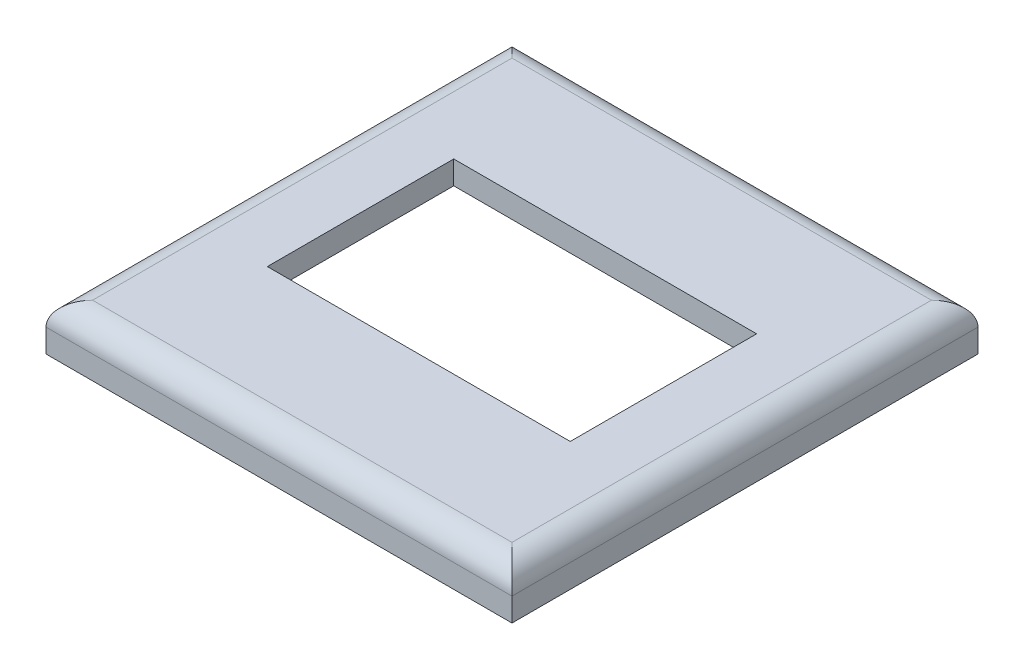
from build123d import *

# Parameters (mm, degrees)
SKETCH1_W           = 40
SKETCH1_H           = 40
BOSS_EXTRUDE1_DEPTH = 4
FILLET2_R           = 2
SHELL1_START        = 2
SHELL1_OUTLINE_W    = 2
SHELL1_OUTLINE_H    = 36
SHELL1_DEPTH        = 36
SKETCH2_W           = 26
SKETCH2_H           = 16
CUT_EXTRUDE1_DEPTH  = 4


# Read off the part's stored shape, not the designer's step: Shell1
with BuildPart() as part:
    # Sketch1 → Boss-Extrude1 (new body)
    with BuildSketch(Plane(origin=(0, 0, 0), x_dir=(1, 0, 0), z_dir=(0, 1, 0))):
        with Locations((20, 20)):
            Rectangle(SKETCH1_W, SKETCH1_H)
    extrude(amount=BOSS_EXTRUDE1_DEPTH)

    # Fillet2
    fillet2_edges = [part.edges().sort_by_distance(p)[0] for p in [
        (40, 4, -20),
        (20, 4, -40),
        (0, 4, -20),
        (20, 4, 0),
    ]]
    fillet(fillet2_edges, radius=FILLET2_R)

    # Shell1 outline → Shell1 (cut)
    with BuildSketch(Plane.YZ.offset(SHELL1_START)):
        with Locations((1, -20)):
            Rectangle(SHELL1_OUTLINE_W, SHELL1_OUTLINE_H)
    extrude(amount=SHELL1_DEPTH, mode=Mode.SUBTRACT)

    # Sketch2 → Cut-Extrude1 (cut)
    with BuildSketch(Plane(origin=(0, 4, 0), x_dir=(1, 0, 0), z_dir=(0, 1, 0))):
        with Locations((20, 20)):
            Rectangle(SKETCH2_W, SKETCH2_H)
    extrude(amount=-CUT_EXTRUDE1_DEPTH, mode=Mode.SUBTRACT)


solid = part.part
